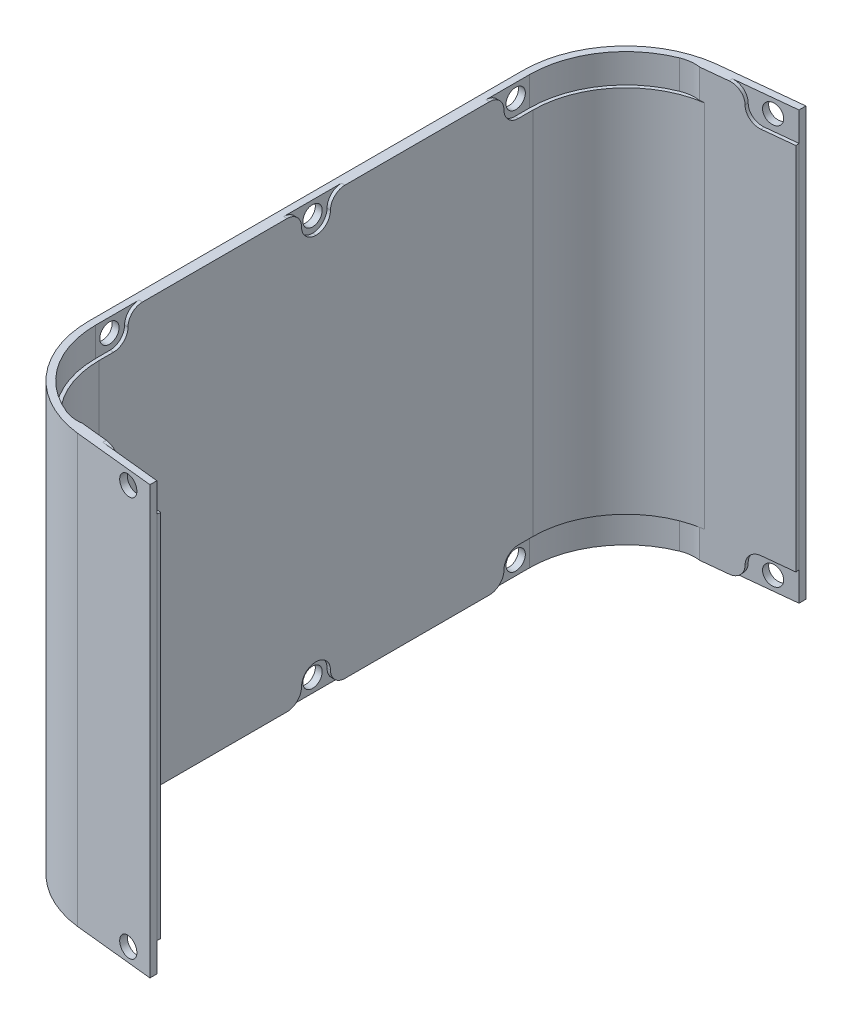
from build123d import *

# Parameters (mm, degrees)
EXTRUDE_1_DEPTH     = 62
CUT_EXTRUDE_1_REACH = 83.766
SKETCH_3_R          = 1.4
CUT_EXTRUDE_2_REACH = 115.398
SKETCH_4_R          = 1.4
CUT_EXTRUDE_3_REACH = 115.398
SKETCH_5_R          = 1.4
SKETCH_6_W          = 25.180002444
SKETCH_6_H          = 4.2
SKETCH_6_H_2        = 53.6
SKETCH_6_W_2        = 25.180002445
SKETCH_6_W_3        = 4.2
EXTRUDE_2_DEPTH     = 0.5
EXTRUDE_START       = -53.6
EXTRUDE_8_DEPTH     = 53.6
SKETCH_8_W          = 6
SKETCH_8_H          = 62
SKETCH_8_W_2        = 11.714967937
SKETCH_8_H_2        = 53.6
EXTRUDE_9_DEPTH     = 0.5
EXTRUDE_10_DEPTH    = 0.5
FILLET_START        = -45.102583308
FILLET_1_DEPTH      = 0.5
FILLET_START_2      = -12.000000001
FILLET_1_2_DEPTH    = 0.5
FILLET_1_3_DEPTH    = 0.5
FILLET_1_4_DEPTH    = 1.102583308
FILLET_1_5_DEPTH    = 12.05640865
FILLET_1_6_DEPTH    = 1.102583308
FILLET_2_R          = 5


with BuildPart() as part:
    # 스케치1 → 보스-돌출1 (new body)
    with BuildSketch(Plane(origin=(0, 0, 0), x_dir=(1, 0, 0), z_dir=(0, 1, 0))):
        with BuildLine():
            Line((12, 47.6), (0.237305416, 46.376143554))
            ThreePointArc((0.237305416, 46.376143554), (-9.212526729, 41.443970389), (-13.000000001, 31.48))
            Line((-13.000000001, 31.48), (-13.000000001, -31.48))
            ThreePointArc((-13.000000001, -31.48), (-9.212526729, -41.443970389), (0.237305416, -46.376143554))
            Line((0.237305416, -46.376143554), (12, -47.6))
            Line((12, -47.6), (12, -46.594601828))
            Line((12, -46.594601828), (0.347931928, -45.382255583))
            ThreePointArc((0.347931928, -45.382255583), (-8.467329474, -40.777116618), (-12.000000001, -31.48))
            Line((-12.000000001, -31.48), (-12.000000001, 31.480004889))
            ThreePointArc((-12.000000001, 31.480004889), (-8.46732785, 40.777118446), (0.347931928, 45.382255583))
            Line((0.347931928, 45.382255583), (12, 46.594601828))
            Line((12, 46.594601828), (12, 47.6))
        make_face()
    extrude(amount=EXTRUDE_1_DEPTH)

    # 스케치3 → 컷-돌출1 (cut, up to next)
    with BuildSketch(Plane(origin=(-12.000000001, 0, 0), x_dir=(0, 0, -1), z_dir=(1, 0, 0)), mode=Mode.PRIVATE) as cut_extrude_1_sk1:
        with Locations((-29.48, 60)):
            Circle(SKETCH_3_R)
    cut_extrude_1_tool1 = extrude(cut_extrude_1_sk1.sketch, amount=-CUT_EXTRUDE_1_REACH, mode=Mode.PRIVATE) & part.part
    # 스케치3 → 컷-돌출1 (cut, up to next)
    with BuildSketch(Plane(origin=(-12.000000001, 0, 0), x_dir=(0, 0, -1), z_dir=(1, 0, 0)), mode=Mode.PRIVATE) as cut_extrude_1_sk2:
        with Locations((29.480004889, 60)):
            Circle(SKETCH_3_R)
    cut_extrude_1_tool2 = extrude(cut_extrude_1_sk2.sketch, amount=-CUT_EXTRUDE_1_REACH, mode=Mode.PRIVATE) & part.part
    # 스케치3 → 컷-돌출1 (cut, up to next)
    with BuildSketch(Plane(origin=(-12.000000001, 0, 0), x_dir=(0, 0, -1), z_dir=(1, 0, 0)), mode=Mode.PRIVATE) as cut_extrude_1_sk3:
        with Locations((-29.48, 2)):
            Circle(SKETCH_3_R)
    cut_extrude_1_tool3 = extrude(cut_extrude_1_sk3.sketch, amount=-CUT_EXTRUDE_1_REACH, mode=Mode.PRIVATE) & part.part
    # 스케치3 → 컷-돌출1 (cut, up to next)
    with BuildSketch(Plane(origin=(-12.000000001, 0, 0), x_dir=(0, 0, -1), z_dir=(1, 0, 0)), mode=Mode.PRIVATE) as cut_extrude_1_sk4:
        with Locations((29.480004889, 2)):
            Circle(SKETCH_3_R)
    cut_extrude_1_tool4 = extrude(cut_extrude_1_sk4.sketch, amount=-CUT_EXTRUDE_1_REACH, mode=Mode.PRIVATE) & part.part
    # 스케치3 → 컷-돌출1 (cut, up to next)
    with BuildSketch(Plane(origin=(-12.000000001, 0, 0), x_dir=(0, 0, -1), z_dir=(1, 0, 0)), mode=Mode.PRIVATE) as cut_extrude_1_sk5:
        with Locations((2.445e-06, 2)):
            Circle(SKETCH_3_R)
    cut_extrude_1_tool5 = extrude(cut_extrude_1_sk5.sketch, amount=-CUT_EXTRUDE_1_REACH, mode=Mode.PRIVATE) & part.part
    # 스케치3 → 컷-돌출1 (cut, up to next)
    with BuildSketch(Plane(origin=(-12.000000001, 0, 0), x_dir=(0, 0, -1), z_dir=(1, 0, 0)), mode=Mode.PRIVATE) as cut_extrude_1_sk6:
        with Locations((2.445e-06, 60)):
            Circle(SKETCH_3_R)
    cut_extrude_1_tool6 = extrude(cut_extrude_1_sk6.sketch, amount=-CUT_EXTRUDE_1_REACH, mode=Mode.PRIVATE) & part.part
    add(cut_extrude_1_tool1.solids().sort_by_distance((-12, 60, 29.48))[0], mode=Mode.SUBTRACT)
    add(cut_extrude_1_tool2.solids().sort_by_distance((-12, 60, -29.480005))[0], mode=Mode.SUBTRACT)
    add(cut_extrude_1_tool3.solids().sort_by_distance((-12, 2, 29.48))[0], mode=Mode.SUBTRACT)
    add(cut_extrude_1_tool4.solids().sort_by_distance((-12, 2, -29.480005))[0], mode=Mode.SUBTRACT)
    add(cut_extrude_1_tool5.solids().sort_by_distance((-12, 2, -2e-06))[0], mode=Mode.SUBTRACT)
    add(cut_extrude_1_tool6.solids().sort_by_distance((-12, 60, -2e-06))[0], mode=Mode.SUBTRACT)

    # 스케치4 → 컷-돌출2 (cut, up to next)
    with BuildSketch(Plane(origin=(-4.771015515, 0, 45.85504987), x_dir=(0.9946308119914395, 0, 0.10348694525035429), z_dir=(-0.10348694525035429, 0, 0.9946308119914395)), mode=Mode.PRIVATE) as cut_extrude_2_sk1:
        with Locations((13.335356707, 60)):
            Circle(SKETCH_4_R)
    cut_extrude_2_tool1 = extrude(cut_extrude_2_sk1.sketch, amount=-CUT_EXTRUDE_2_REACH, mode=Mode.PRIVATE) & part.part
    # 스케치4 → 컷-돌출2 (cut, up to next)
    with BuildSketch(Plane(origin=(-4.771015515, 0, 45.85504987), x_dir=(0.9946308119914395, 0, 0.10348694525035429), z_dir=(-0.10348694525035429, 0, 0.9946308119914395)), mode=Mode.PRIVATE) as cut_extrude_2_sk2:
        with Locations((13.335356707, 2)):
            Circle(SKETCH_4_R)
    cut_extrude_2_tool2 = extrude(cut_extrude_2_sk2.sketch, amount=-CUT_EXTRUDE_2_REACH, mode=Mode.PRIVATE) & part.part
    add(cut_extrude_2_tool1.solids().sort_by_distance((8.492741, 60, 47.235085))[0], mode=Mode.SUBTRACT)
    add(cut_extrude_2_tool2.solids().sort_by_distance((8.492741, 2, 47.235085))[0], mode=Mode.SUBTRACT)

    # 스케치5 → 컷-돌출3 (cut, up to next)
    with BuildSketch(Plane(origin=(-4.771015515, 0, -45.85504987), x_dir=(-0.9946308119914237, 0, 0.10348694525050525), z_dir=(-0.10348694525050527, 0, -0.9946308119914238)), mode=Mode.PRIVATE) as cut_extrude_3_sk1:
        with Locations((-13.335356707, 60)):
            Circle(SKETCH_5_R)
    cut_extrude_3_tool1 = extrude(cut_extrude_3_sk1.sketch, amount=-CUT_EXTRUDE_3_REACH, mode=Mode.PRIVATE) & part.part
    # 스케치5 → 컷-돌출3 (cut, up to next)
    with BuildSketch(Plane(origin=(-4.771015515, 0, -45.85504987), x_dir=(-0.9946308119914237, 0, 0.10348694525050525), z_dir=(-0.10348694525050527, 0, -0.9946308119914238)), mode=Mode.PRIVATE) as cut_extrude_3_sk2:
        with Locations((-13.335356707, 2)):
            Circle(SKETCH_5_R)
    cut_extrude_3_tool2 = extrude(cut_extrude_3_sk2.sketch, amount=-CUT_EXTRUDE_3_REACH, mode=Mode.PRIVATE) & part.part
    add(cut_extrude_3_tool1.solids().sort_by_distance((8.492741, 60, -47.235085))[0], mode=Mode.SUBTRACT)
    add(cut_extrude_3_tool2.solids().sort_by_distance((8.492741, 2, -47.235085))[0], mode=Mode.SUBTRACT)

    # 스케치6 → 보스-돌출2 (add)
    with BuildSketch(Plane(origin=(-12.000000001, 0, 0), x_dir=(0, 0, -1), z_dir=(1, 0, 0))):
        with Locations((14.690003667, 59.9)):
            Rectangle(SKETCH_6_W, SKETCH_6_H)
        with Locations((14.690003667, 31)):
            Rectangle(SKETCH_6_W, SKETCH_6_H_2)
        with Locations((14.690003667, 2.1)):
            Rectangle(SKETCH_6_W, SKETCH_6_H)
        with Locations((-14.689998778, 59.9)):
            Rectangle(SKETCH_6_W_2, SKETCH_6_H)
        with Locations((-14.689998778, 2.1)):
            Rectangle(SKETCH_6_W_2, SKETCH_6_H)
        with Locations((-29.38, 31)):
            Rectangle(SKETCH_6_W_3, SKETCH_6_H_2)
        with Locations((29.380004889, 31)):
            Rectangle(SKETCH_6_W_3, SKETCH_6_H_2)
        with Locations((-14.689998778, 31)):
            Rectangle(SKETCH_6_W_2, SKETCH_6_H_2)
        with Locations((2.445e-06, 31)):
            Rectangle(SKETCH_6_W_3, SKETCH_6_H_2)
    extrude(amount=EXTRUDE_2_DEPTH)

    # 보스-돌출8: read off the stored shape, not the designer's step
    # 보스-돌출8 outline → 보스-돌출8 (add)
    with BuildSketch(Plane(origin=(0, 57.8, 0), x_dir=(1, 0, 0), z_dir=(0, 1, 0)).offset(EXTRUDE_START)):
        with BuildLine():
            ThreePointArc((-11.500000001, 31.480004889), (-8.210419566, 40.311683176), (0.055228076, 44.839259774))
            Line((0.055228076, 44.839259774), (0.116060525, 45.352736101))
            ThreePointArc((0.116060525, 45.352736101), (-8.544574488, 40.689413647), (-12.000000001, 31.480004889))
            Line((-12.000000001, 31.480004889), (-11.500000001, 31.480004889))
        make_face()
        with BuildLine():
            ThreePointArc((0.406934359, -44.885749074), (-8.093497148, -40.445078379), (-11.500000001, -31.48))
            Line((-11.500000001, -31.48), (-12.000000001, -31.48))
            ThreePointArc((-12.000000001, -31.48), (-8.467329474, -40.777116618), (0.347931928, -45.382255583))
            Line((0.347931928, -45.382255583), (0.406934359, -44.885749074))
        make_face()
    extrude(amount=EXTRUDE_8_DEPTH)

    # 스케치8 → 보스-돌출9 (add)
    with BuildSketch(Plane(origin=(-4.667528569, 0, 44.860419058), x_dir=(-0.9946308119914395, 0, -0.10348694525035321), z_dir=(0.10348694525035321, 0, -0.9946308119914395))):
        with Locations((-7.042534815, 31)):
            Rectangle(SKETCH_8_W, SKETCH_8_H)
        with Locations((-10.900018784, 31)):
            Rectangle(SKETCH_8_W_2, SKETCH_8_H_2)
    extrude(amount=EXTRUDE_9_DEPTH)

    # 스케치9 → 보스-돌출10 (add)
    with BuildSketch(Plane(origin=(-4.667528569, 0, -44.860419058), x_dir=(0.9946308119914264, 0, -0.10348694525048052), z_dir=(0.10348694525048052, 0, 0.9946308119914264))):
        Polygon((16.757502752, 4.2), (16.757502752, 57.8), (10.042534815, 57.8), (10.042534815, 62), (4.042534815, 62), (4.042534815, 0), (10.042534815, 0), (10.042534815, 4.2), align=None)
    extrude(amount=EXTRUDE_10_DEPTH)

    # 필렛1: read off the stored shape, not the designer's step
    # 필렛1 outline → 필렛1 (add)
    with BuildSketch(Plane(origin=(0, 0, 0), x_dir=(0.9946308119914397, 0, 0.10348694525035299), z_dir=(0.10348694525035297, 0, -0.9946308119914397)).offset(FILLET_START)):
        with BuildLine():
            ThreePointArc((10.042534815, -59.9), (10.657610575, -58.415075759), (12.142534815, -57.8))
            Line((12.142534815, -57.8), (10.042534815, -57.8))
            Line((10.042534815, -57.8), (10.042534815, -59.9))
        make_face()
        with BuildLine():
            Line((10.042534815, -4.2), (12.142534815, -4.2))
            ThreePointArc((12.142534815, -4.2), (10.657610574, -3.58492424), (10.042534815, -2.1))
            Line((10.042534815, -2.1), (10.042534815, -4.2))
        make_face()
    extrude(amount=FILLET_1_DEPTH)

    # Fillet 1 2 outline → Fillet 1 2 (add)
    with BuildSketch(Plane.YZ.offset(FILLET_START_2)):
        with BuildLine():
            Line((4.2, 27.28), (4.2, 29.38))
            ThreePointArc((4.2, 29.38), (3.58492424, 27.89507576), (2.1, 27.28))
            Line((2.1, 27.28), (4.2, 27.28))
        make_face()
        with BuildLine():
            Line((4.2, -27.280004889), (2.1, -27.280004889))
            ThreePointArc((2.1, -27.280004889), (3.58492424, -27.895080649), (4.2, -29.380004889))
            Line((4.2, -29.380004889), (4.2, -27.280004889))
        make_face()
        with BuildLine():
            Line((4.2, 2.099997555), (2.1, 2.099997555))
            ThreePointArc((2.1, 2.099997555), (3.584924241, 1.484921796), (4.2, -2.445e-06))
            Line((4.2, -2.445e-06), (4.2, 2.099997555))
        make_face()
        with BuildLine():
            Line((4.2, -2.100002445), (4.2, -2.445e-06))
            ThreePointArc((4.2, -2.445e-06), (3.58492424, -1.484926685), (2.1, -2.100002445))
            Line((2.1, -2.100002445), (4.2, -2.100002445))
        make_face()
        with BuildLine():
            Line((57.8, -27.280004889), (57.8, -29.380004889))
            ThreePointArc((57.8, -29.380004889), (58.41507576, -27.895080649), (59.9, -27.280004889))
            Line((59.9, -27.280004889), (57.8, -27.280004889))
        make_face()
        with BuildLine():
            Line((57.8, 27.28), (59.9, 27.28))
            ThreePointArc((59.9, 27.28), (58.41507576, 27.89507576), (57.8, 29.38))
            Line((57.8, 29.38), (57.8, 27.28))
        make_face()
        with BuildLine():
            Line((57.8, -2.100002445), (59.9, -2.100002445))
            ThreePointArc((59.9, -2.100002445), (58.41507576, -1.484926685), (57.8, -2.445e-06))
            Line((57.8, -2.445e-06), (57.8, -2.100002445))
        make_face()
        with BuildLine():
            Line((57.8, 2.099997555), (57.8, -2.445e-06))
            ThreePointArc((57.8, -2.445e-06), (58.415075759, 1.484921795), (59.9, 2.099997555))
            Line((59.9, 2.099997555), (57.8, 2.099997555))
        make_face()
    extrude(amount=FILLET_1_2_DEPTH)

    # Fillet 1 3 outline → Fillet 1 3 (add)
    with BuildSketch(Plane(origin=(0, 0, 0), x_dir=(0.9946308119914263, 0, -0.10348694525048104), z_dir=(0.10348694525048102, 0, 0.9946308119914263)).offset(FILLET_START)):
        with BuildLine():
            ThreePointArc((10.042534815, 2.1), (10.657610574, 3.58492424), (12.142534815, 4.2))
            Line((12.142534815, 4.2), (10.042534815, 4.2))
            Line((10.042534815, 4.2), (10.042534815, 2.1))
        make_face()
        with BuildLine():
            ThreePointArc((12.142534815, 57.8), (10.657610575, 58.415075759), (10.042534815, 59.9))
            Line((10.042534815, 59.9), (10.042534815, 57.8))
            Line((10.042534815, 57.8), (12.142534815, 57.8))
        make_face()
    extrude(amount=FILLET_1_3_DEPTH)

    # Fillet 1 4 outline → Fillet 1 4 (cut)
    with BuildSketch(Plane(origin=(0, 0, 0), x_dir=(0.9946308119914397, 0, 0.10348694525035299), z_dir=(0.10348694525035297, 0, -0.9946308119914397)).offset(FILLET_START)):
        with BuildLine():
            Line((10.042534815, -62), (10.042534815, -59.9))
            ThreePointArc((10.042534815, -59.9), (9.427459055, -61.38492424), (7.942534815, -62))
            Line((7.942534815, -62), (10.042534815, -62))
        make_face()
        with BuildLine():
            ThreePointArc((7.942534815, 0), (9.427459055, -0.61507576), (10.042534815, -2.1))
            Line((10.042534815, -2.1), (10.042534815, 0))
            Line((10.042534815, 0), (7.942534815, 0))
        make_face()
    extrude(amount=FILLET_1_4_DEPTH, mode=Mode.SUBTRACT)

    # Fillet 1 5 outline → Fillet 1 5 (cut)
    with BuildSketch(Plane.YZ.offset(FILLET_START_2)):
        with BuildLine():
            ThreePointArc((2.1, -27.280004889), (0.615075759, -26.664929129), (0, -25.180004889))
            Line((0, -25.180004889), (0, -27.280004889))
            Line((0, -27.280004889), (2.1, -27.280004889))
        make_face()
        with BuildLine():
            ThreePointArc((2.1, 2.099997555), (0.61507576, 2.715073315), (0, 4.199997555))
            Line((0, 4.199997555), (0, 2.099997555))
            Line((0, 2.099997555), (2.1, 2.099997555))
        make_face()
        with BuildLine():
            ThreePointArc((0, 25.18), (0.61507576, 26.66492424), (2.1, 27.28))
            Line((2.1, 27.28), (0, 27.28))
            Line((0, 27.28), (0, 25.18))
        make_face()
        with BuildLine():
            Line((2.1, -2.100002445), (0, -2.100002445))
            Line((0, -2.100002445), (0, -4.200002445))
            ThreePointArc((0, -4.200002445), (0.61507576, -2.715078205), (2.1, -2.100002445))
        make_face()
        with BuildLine():
            ThreePointArc((59.9, 27.28), (61.38492424, 26.66492424), (62, 25.18))
            Line((62, 25.18), (62, 27.28))
            Line((62, 27.28), (59.9, 27.28))
        make_face()
        with BuildLine():
            ThreePointArc((59.9, -2.100002445), (61.38492424, -2.715078205), (62, -4.200002445))
            Line((62, -4.200002445), (62, -2.100002445))
            Line((62, -2.100002445), (59.9, -2.100002445))
        make_face()
        with BuildLine():
            ThreePointArc((62, -25.180004889), (61.38492424, -26.664929129), (59.9, -27.280004889))
            Line((59.9, -27.280004889), (62, -27.280004889))
            Line((62, -27.280004889), (62, -25.180004889))
        make_face()
        with BuildLine():
            Line((59.9, 2.099997555), (62, 2.099997555))
            Line((62, 2.099997555), (62, 4.199997555))
            ThreePointArc((62, 4.199997555), (61.38492424, 2.715073315), (59.9, 2.099997555))
        make_face()
    extrude(amount=FILLET_1_5_DEPTH, mode=Mode.SUBTRACT)

    # Fillet 1 6 outline → Fillet 1 6 (cut)
    with BuildSketch(Plane(origin=(0, 0, 0), x_dir=(0.9946308119914263, 0, -0.10348694525048104), z_dir=(0.10348694525048102, 0, 0.9946308119914263)).offset(FILLET_START)):
        with BuildLine():
            Line((10.042534815, 0), (10.042534815, 2.1))
            ThreePointArc((10.042534815, 2.1), (9.427459055, 0.61507576), (7.942534815, 0))
            Line((7.942534815, 0), (10.042534815, 0))
        make_face()
        with BuildLine():
            Line((10.042534815, 62), (7.942534815, 62))
            ThreePointArc((7.942534815, 62), (9.427459055, 61.38492424), (10.042534815, 59.9))
            Line((10.042534815, 59.9), (10.042534815, 62))
        make_face()
    extrude(amount=FILLET_1_6_DEPTH, mode=Mode.SUBTRACT)

    # 필렛2
    # the kernel refuses this fillet: 5 mm, written as the material it adds along each edge
    with BuildSketch(Plane(origin=(-0.641481296, 10.854323903, -45.228621503), x_dir=(0.10348694525046676, 0, 0.9946308119914278), z_dir=(0, -1, 0))) as fillet_2_piece_1_section:
        with BuildLine():
            CenterArc((5.290068801, 1.252872343), FILLET_2_R, 164.15465064, 30.356858226)
            Line((0.480057883, 2.618081108), (0.383857665, 2.645385283))
            ThreePointArc((0.383857665, 2.645385283), (0.079307734, 1.338510795), (-0.099629203, 0.008603596))
            Line((-0.099629203, 0.008603596), (0, -0.1))
            ThreePointArc((0, -0.1), (0.224791081, -0.1), (0.35277243, -0.025057447))
            Line((0.35277243, -0.025057447), (0.449582163, 0))
        make_face()
    fillet_2_piece_1 = extrude(amount=10.854323903, mode=Mode.PRIVATE)
    fillet_2_piece_1 = split(fillet_2_piece_1, bisect_by=Plane(origin=(-0.594955411, 10.854323903, -44.781453231), z_dir=(-0.10348694525048052, 0, -0.9946308119914264)), keep=Keep.TOP, mode=Mode.PRIVATE)
    add(fillet_2_piece_1)
    with BuildSketch(Plane(origin=(-0.641481296, 62, -45.228621503), x_dir=(0.10348694525044558, 0, 0.99463081199143), z_dir=(0, -1, 0))) as fillet_2_piece_2_section:
        with BuildLine():
            CenterArc((5.290068801, 1.252872343), FILLET_2_R, 164.15465064, 30.356858226)
            Line((0.480057883, 2.618081108), (0.383857665, 2.645385283))
            ThreePointArc((0.383857665, 2.645385283), (0.079307734, 1.338510795), (-0.099629203, 0.008603596))
            Line((-0.099629203, 0.008603596), (0, -0.1))
            ThreePointArc((0, -0.1), (0.224791081, -0.1), (0.35277243, -0.025057447))
            Line((0.35277243, -0.025057447), (0.449582163, 0))
        make_face()
    fillet_2_piece_2 = extrude(amount=10.854323903, mode=Mode.PRIVATE)
    fillet_2_piece_2 = split(fillet_2_piece_2, bisect_by=Plane(origin=(-0.594955411, 62, -44.781453231), z_dir=(-0.10348694525048052, 0, -0.9946308119914264)), keep=Keep.TOP, mode=Mode.PRIVATE)
    add(fillet_2_piece_2)
    with BuildSketch(Plane(origin=(-0.641481296, 10.854323903, 45.228621503), x_dir=(-0.9596558761165634, 0, -0.2811771673428536), z_dir=(0, -1, 0))) as fillet_2_piece_3_section:
        with BuildLine():
            CenterArc((2.186420711, 4.977356879), FILLET_2_R, 245.098016839, 30.356858226)
            Line((0.081084669, 0.442209676), (0.038977948, 0.351506732))
            ThreePointArc((0.038977948, 0.351506732), (-0.057817812, 0.2391404), (-0.098360147, 0.018035562))
            Line((-0.098360147, 0.018035562), (-0.009506177, -0.099547138))
            ThreePointArc((-0.009506177, -0.099547138), (1.330864781, -0.16340074), (2.671235738, -0.099547138))
            Line((2.671235738, -0.099547138), (2.661729561, 0))
        make_face()
    fillet_2_piece_3 = extrude(amount=10.854323903, mode=Mode.PRIVATE)
    fillet_2_piece_3 = split(fillet_2_piece_3, bisect_by=Plane(origin=(-0.594955411, 10.854323903, 44.781453231), z_dir=(-0.10348694525035321, 0, 0.9946308119914395)), keep=Keep.TOP, mode=Mode.PRIVATE)
    add(fillet_2_piece_3)
    with BuildSketch(Plane(origin=(-0.641481296, 62, 45.228621503), x_dir=(0.10348694525036113, 0, -0.9946308119914388), z_dir=(0, -1, 0))) as fillet_2_piece_4_section:
        with BuildLine():
            CenterArc((5.290068801, -1.252872343), FILLET_2_R, 165.488491133, 30.356858226)
            Line((0.480057883, -2.618081108), (0.383857665, -2.645385283))
            ThreePointArc((0.383857665, -2.645385283), (0.079307734, -1.338510795), (-0.099629203, -0.008603596))
            Line((-0.099629203, -0.008603596), (0, 0.1))
            ThreePointArc((0, 0.1), (0.224791081, 0.1), (0.35277243, 0.025057447))
            Line((0.35277243, 0.025057447), (0.449582163, 0))
        make_face()
    fillet_2_piece_4 = extrude(amount=10.854323903, mode=Mode.PRIVATE)
    fillet_2_piece_4 = split(fillet_2_piece_4, bisect_by=Plane(origin=(-0.594955411, 62, 44.781453231), z_dir=(-0.10348694525035321, 0, 0.9946308119914395)), keep=Keep.TOP, mode=Mode.PRIVATE)
    add(fillet_2_piece_4)


solid = part.part
